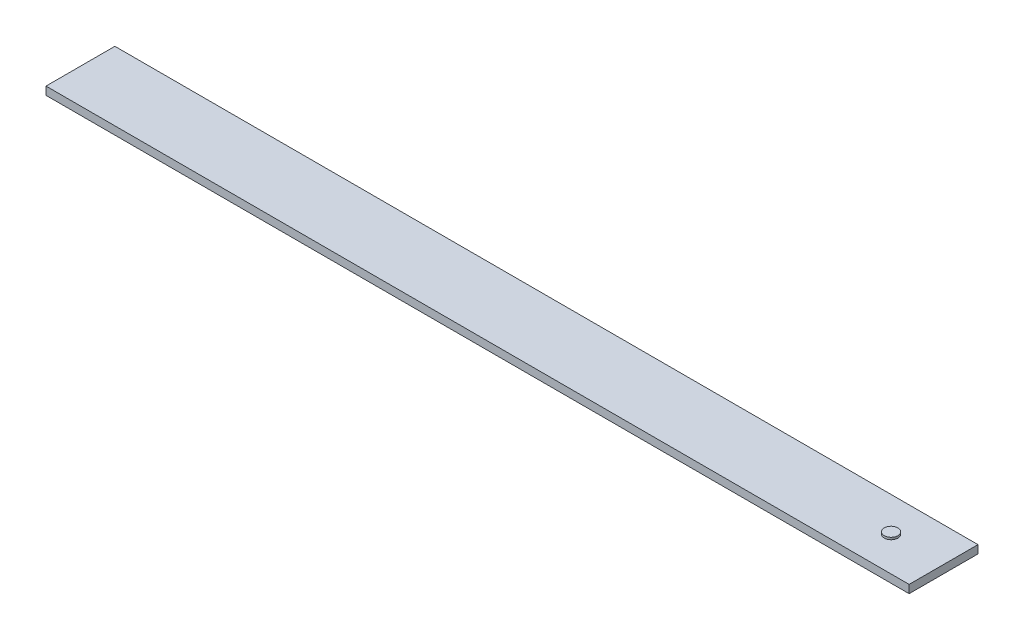
from build123d import *

# Parameters (mm, degrees)
ESBO_O1_W                = 401
ESBO_O1_H                = 32
RESSALTO_EXTRUS_O1_DEPTH = 3.75
ESBO_O6_R                = 3.15
RESSALTO_EXTRUS_O3_DEPTH = 1


with BuildPart() as part:
    # Esboço1 → Ressalto-extrusão1 (new body)
    with BuildSketch(Plane(origin=(0, 0, 0), x_dir=(1, 0, 0), z_dir=(0, 1, 0))):
        with Locations((200.5, 16)):
            Rectangle(ESBO_O1_W, ESBO_O1_H)
    extrude(amount=RESSALTO_EXTRUS_O1_DEPTH)

    # Esboço6 → Ressalto-extrusão3 (add)
    with BuildSketch(Plane(origin=(0, 3.75, 0), x_dir=(1, 0, 0), z_dir=(0, 1, 0))):
        with Locations((376.65, 16)):
            Circle(ESBO_O6_R)
    extrude(amount=RESSALTO_EXTRUS_O3_DEPTH)


solid = part.part
